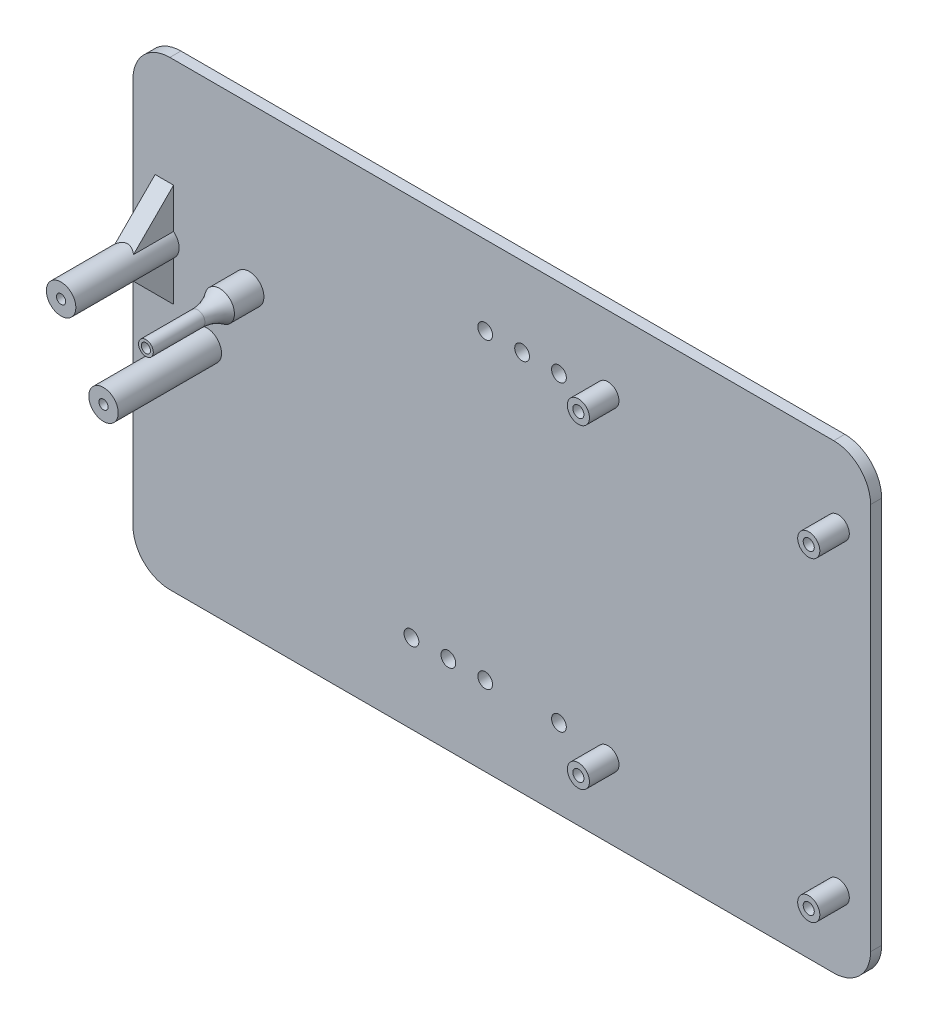
from build123d import *

# Parameters (mm, degrees)
SKETCH_1_W          = 200
SKETCH_1_H          = 125
EXTRUDE_1_DEPTH     = 3
SKETCH_2_R          = 4
SKETCH_2_R_2        = 2
EXTRUDE_2_DEPTH     = 28
SKETCH_3_R          = 1.25
CUT_EXTRUDE_1_DEPTH = 10
SKETCH_4_R          = 2
CUT_EXTRUDE_2_DEPTH = 122.203341538
SKETCH_5_R          = 3
EXTRUDE_3_DEPTH     = 8
SKETCH_6_R          = 1.5
CUT_EXTRUDE_3_DEPTH = 8
FILLET_1_R          = 10
RIB_1_REACH         = 205.812
SKETCH_9_WALL_W     = 423.76696313
SKETCH_9_WALL_H     = 5
RIB_2_REACH         = 205.812
SKETCH_10_WALL_W    = 423.76696313
SKETCH_10_WALL_H    = 5
SKETCH_13_R         = 4
EXTRUDE_4_DEPTH     = 8
FILLET_3_R          = 10
SKETCH_14_R         = 1.25
CUT_EXTRUDE_4_DEPTH = 8


with BuildPart() as part:
    # 草图1 → 凸台-拉伸1 (new body)
    with BuildSketch(Plane.XY):
        Rectangle(SKETCH_1_W, SKETCH_1_H)
    extrude(amount=EXTRUDE_1_DEPTH)

    # 草图2 → 凸台-拉伸2 (add)
    with BuildSketch(Plane.XY.offset(3)):
        with Locations(Location((-91.5, 19, 0), (0, 0, 180))):
            Circle(SKETCH_2_R)
        with Locations(Location((-68.5, 19, 0), (0, 0, 180))):
            Circle(SKETCH_2_R_2)
        with Locations(Location((-80, 0, 0), (0, 0, 180))):
            Circle(SKETCH_2_R)
    extrude(amount=EXTRUDE_2_DEPTH)

    # 草图3 → 切除-拉伸1 (cut)
    with BuildSketch(Plane.XY.offset(31)):
        with Locations((-91.5, 19)):
            Circle(SKETCH_3_R)
        with Locations((-68.5, 19)):
            Circle(SKETCH_3_R)
    extrude(amount=-CUT_EXTRUDE_1_DEPTH, mode=Mode.SUBTRACT)

    # 草图4 → 切除-拉伸2 (cut, through all)
    with BuildSketch(Plane.XY.offset(3)):
        with Locations((15.5, 41)):
            Circle(SKETCH_4_R)
        with Locations((15.5, -41)):
            Circle(SKETCH_4_R)
        with Locations((5.5, 41)):
            Circle(SKETCH_4_R)
        with Locations((-4.5, 41)):
            Circle(SKETCH_4_R)
        with Locations((-14.5, -41)):
            Circle(SKETCH_4_R)
        with Locations((-24.5, -41)):
            Circle(SKETCH_4_R)
        with Locations((-4.5, -41)):
            Circle(SKETCH_4_R)
    extrude(amount=-CUT_EXTRUDE_2_DEPTH, mode=Mode.SUBTRACT)

    # 草图5 → 凸台-拉伸3 (add)
    with BuildSketch(Plane.XY.offset(3)):
        with Locations(Location((28.77, 42.73, 0), (0, 0, 180))):
            Circle(SKETCH_5_R)
        with Locations(Location((28.77, -42.73, 0), (0, 0, 180))):
            Circle(SKETCH_5_R)
        with Locations(Location((91.23, -42.73, 0), (0, 0, 180))):
            Circle(SKETCH_5_R)
        with Locations(Location((91.23, 42.73, 0), (0, 0, 180))):
            Circle(SKETCH_5_R)
    extrude(amount=EXTRUDE_3_DEPTH)

    # 草图6 → 切除-拉伸3 (cut)
    with BuildSketch(Plane.XY.offset(11)):
        with Locations((28.77, 42.73)):
            Circle(SKETCH_6_R)
        with Locations((91.23, 42.73)):
            Circle(SKETCH_6_R)
        with Locations((28.77, -42.73)):
            Circle(SKETCH_6_R)
        with Locations((91.23, -42.73)):
            Circle(SKETCH_6_R)
    extrude(amount=-CUT_EXTRUDE_3_DEPTH, mode=Mode.SUBTRACT)

    # 圆角1
    fillet_1_edges = [part.edges().sort_by_distance(p)[0] for p in [
        (100, -62.5, 1.5),
        (-100, -62.5, 1.5),
        (-100, 62.5, 1.5),
        (100, 62.5, 1.5),
    ]]
    fillet(fillet_1_edges, radius=FILLET_1_R)

    # 草图9 wall → 筋1 (add, up to next)
    with BuildSketch(Plane(origin=(-91.5, 28, 8), x_dir=(0, -0.707106781187, 0.707106781187), z_dir=(0, 0.707106781187, 0.707106781187)), mode=Mode.PRIVATE) as rib_1_sk1:
        Rectangle(SKETCH_9_WALL_W, SKETCH_9_WALL_H)
    rib_1_tool1 = extrude(rib_1_sk1.sketch, amount=-RIB_1_REACH, mode=Mode.PRIVATE) - part.part
    add(rib_1_tool1.solids().sort_by_distance((-91.5, 28, 8))[0])

    # 草图10 wall → 筋2 (add, up to next)
    with BuildSketch(Plane(origin=(-91.5, 10, 8), x_dir=(0, -0.707106781187, -0.707106781187), z_dir=(0, -0.707106781187, 0.707106781187)), mode=Mode.PRIVATE) as rib_2_sk1:
        Rectangle(SKETCH_10_WALL_W, SKETCH_10_WALL_H)
    rib_2_tool1 = extrude(rib_2_sk1.sketch, amount=-RIB_2_REACH, mode=Mode.PRIVATE) - part.part
    add(rib_2_tool1.solids().sort_by_distance((-91.5, 10, 8))[0])

    # 草图13 → 凸台-拉伸4 (add)
    with BuildSketch(Plane.XY.offset(3)):
        with Locations(Location((-68.5, 19, 0), (0, 0, 180))):
            Circle(SKETCH_13_R)
    extrude(amount=EXTRUDE_4_DEPTH)

    # 圆角3
    # the kernel refuses this fillet: 10 mm, written as the material it adds along each edge
    with BuildSketch(Plane(origin=(-68.5, 19, 11), x_dir=(-1, 0, 0), z_dir=(0, -1, 0))) as fillet_3_piece_1:
        with BuildLine():
            CenterArc((12, -6), FILLET_3_R, 143.130102354, 36.869897646)
            Line((2, -6), (1.8, -6))
            Line((1.8, -6), (1.8, 0))
            Line((1.8, 0), (2, 0.2))
            ThreePointArc((2, 0.2), (3, 0.2), (3.84, 0.12))
            Line((3.84, 0.12), (4, 0))
        make_face()
    revolve(axis=Axis((-68.5, 19, 11), (0, 0, -1)))

    # 草图14 → 切除-拉伸4 (cut)
    with BuildSketch(Plane.XY.offset(31)):
        with Locations((-80, 0)):
            Circle(SKETCH_14_R)
    extrude(amount=-CUT_EXTRUDE_4_DEPTH, mode=Mode.SUBTRACT)


solid = part.part
